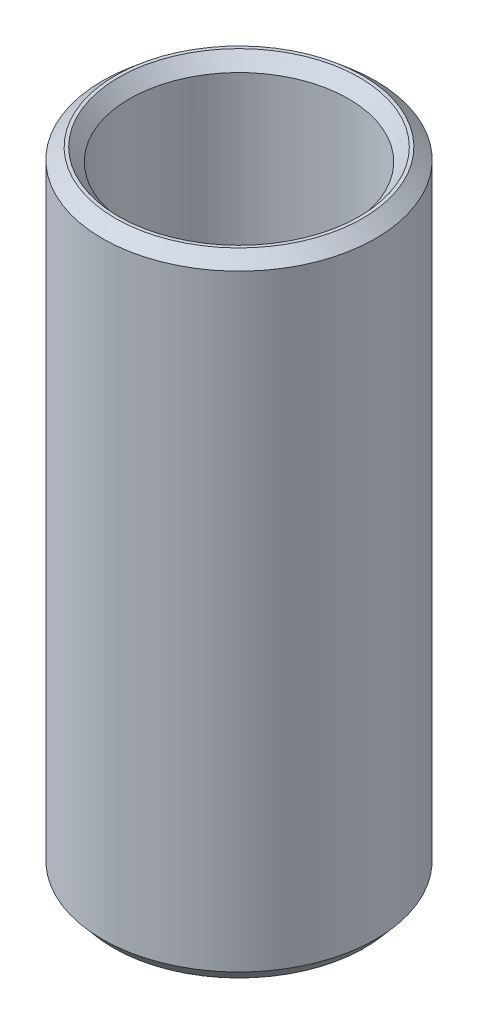
from build123d import *
from OCP.BRepFilletAPI import BRepFilletAPI_MakeChamfer

# Parameters (mm, degrees)
SKETCH1_R           = 30
BOSS_EXTRUDE1_DEPTH = 138.562156971
SKETCH2_R           = 24.033220196
CUT_EXTRUDE1_DEPTH  = 145.911943415
CHAMFER1_SIZE       = 2.41854886
CHAMFER1_SIZE2      = 2.835694631


with BuildPart() as part:
    # Sketch1 → Boss-Extrude1 (new body)
    with BuildSketch(Plane(origin=(0, 0, 0), x_dir=(1, 0, 0), z_dir=(0, 1, 0))):
        Circle(SKETCH1_R)
    extrude(amount=BOSS_EXTRUDE1_DEPTH)

    # Sketch2 → Cut-Extrude1 (cut, through all)
    with BuildSketch(Plane(origin=(0, 0, 0), x_dir=(1, 0, 0), z_dir=(0, 1, 0))):
        Circle(SKETCH2_R)
    extrude(amount=CUT_EXTRUDE1_DEPTH, mode=Mode.SUBTRACT)

    # Chamfer1: one chamfer whose edges measure the first distance from different faces: ONE call of the kernel's chamfer builder (chamfer() names one face for all edges)
    chamfer1_edges_1 = [part.edges().sort_by_distance(p)[0] for p in [
        (-24.033220196, 138.562156971, 0),
    ]]
    chamfer1_side_1 = [part.faces().sort_by_distance(p)[0] for p in [
        (-29.151471863, 138.562156971, 0),
    ]]
    chamfer1_edges_2 = [part.edges().sort_by_distance(p)[0] for p in [
        (-24.033220196, 0, 0),
    ]]
    chamfer1_side_2 = [part.faces().sort_by_distance(p)[0] for p in [
        (-24.033220196, 69.281078485, 0),
    ]]
    chamfer1_edges_3 = [part.edges().sort_by_distance(p)[0] for p in [
        (-30, 0, 0),
    ]]
    chamfer1_side_3 = [part.faces().sort_by_distance(p)[0] for p in [
        (-29.151471863, 0, 0),
    ]]
    chamfer1_edges_4 = [part.edges().sort_by_distance(p)[0] for p in [
        (-30, 138.562156971, 0),
    ]]
    chamfer1_side_4 = [part.faces().sort_by_distance(p)[0] for p in [
        (-30, 69.281078485, 0),
    ]]
    chamfer1 = BRepFilletAPI_MakeChamfer(part.part.solid().wrapped)
    for e in chamfer1_edges_1:
        chamfer1.Add(CHAMFER1_SIZE, CHAMFER1_SIZE2, e.wrapped, chamfer1_side_1[0].wrapped)  # the first distance lies on this face
    for e in chamfer1_edges_2:
        chamfer1.Add(CHAMFER1_SIZE, CHAMFER1_SIZE2, e.wrapped, chamfer1_side_2[0].wrapped)  # the first distance lies on this face
    for e in chamfer1_edges_3:
        chamfer1.Add(CHAMFER1_SIZE, CHAMFER1_SIZE2, e.wrapped, chamfer1_side_3[0].wrapped)  # the first distance lies on this face
    for e in chamfer1_edges_4:
        chamfer1.Add(CHAMFER1_SIZE, CHAMFER1_SIZE2, e.wrapped, chamfer1_side_4[0].wrapped)  # the first distance lies on this face
    add(Compound.cast(chamfer1.Shape()), mode=Mode.REPLACE)


solid = part.part
